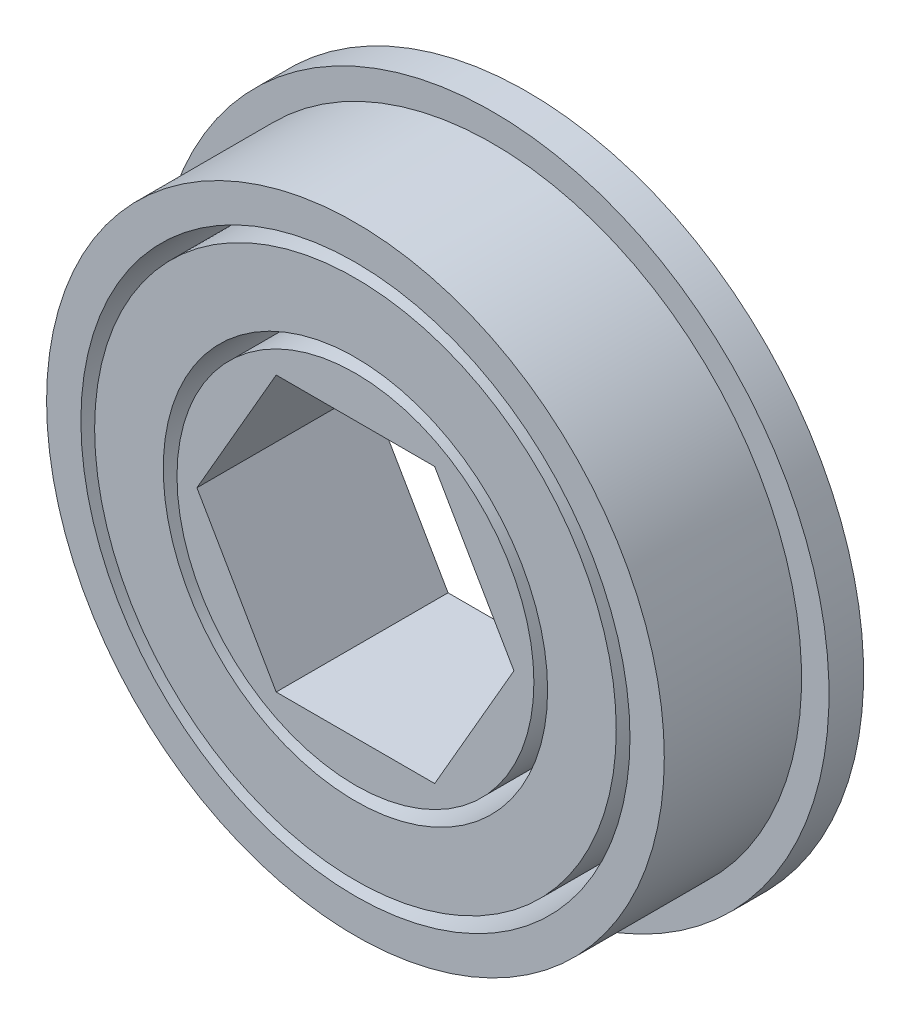
from build123d import *

# Parameters (mm, degrees)
CROQUIS1_R              = 14.2875
SALIENTE_EXTRUIR1_DEPTH = 7.9502
CROQUIS2_R              = 15.5575
CROQUIS2_R_2            = 14.2875
SALIENTE_EXTRUIR2_DEPTH = 1.6002
CROQUIS3_R              = 12.7
CROQUIS3_R_2            = 12.065
CROQUIS3_R_3            = 8.89
CROQUIS3_R_4            = 8.255
CORTAR_EXTRUIR1_DEPTH   = 25.4


with BuildPart() as part:
    # Croquis1 → Saliente-Extruir1 (new body)
    with BuildSketch(Plane.XY):
        Circle(CROQUIS1_R)
        Polygon((7.332348419, 0), (3.666174209, 6.35), (-3.666174209, 6.35), (-7.332348419, 0), (-3.666174209, -6.35), (3.666174209, -6.35), align=None, mode=Mode.SUBTRACT)
    extrude(amount=SALIENTE_EXTRUIR1_DEPTH)

    # Croquis2 → Saliente-Extruir2 (add)
    with BuildSketch(Plane(origin=(0, 0, 0), x_dir=(-1, 0, 0), z_dir=(0, 0, -1))):
        Circle(CROQUIS2_R)
        Circle(CROQUIS2_R_2, mode=Mode.SUBTRACT)
    extrude(amount=-SALIENTE_EXTRUIR2_DEPTH)

    # Croquis3 → Cortar-Extruir1 (cut)
    # profile 1 of 2: a face of its own
    with BuildSketch(Plane.XY.offset(7.9502)):
        Circle(CROQUIS3_R)
        Circle(CROQUIS3_R_2, mode=Mode.SUBTRACT)
    # profile 2 of 2: a face of its own
    with BuildSketch(Plane.XY.offset(7.9502)):
        Circle(CROQUIS3_R_3)
        Circle(CROQUIS3_R_4, mode=Mode.SUBTRACT)
    extrude(amount=-CORTAR_EXTRUIR1_DEPTH, mode=Mode.SUBTRACT)


with BuildPart() as cortar_extruir1_piece_1:
    # of the separate pieces the step leaves, piece 1, a body of its own (cortar_extruir1_pieces)
    add(part.part.solids().sort_by_distance((12.065, 0, 7.9502))[0])


with BuildPart() as cortar_extruir1_piece_2:
    # of the separate pieces the step leaves, piece 2, a body of its own (cortar_extruir1_pieces)
    add(part.part.solids().sort_by_distance((14.2875, 0, 1.6002))[0])


with BuildPart() as cortar_extruir1_piece_3:
    # of the separate pieces the step leaves, piece 3, a body of its own (cortar_extruir1_pieces)
    add(part.part.solids().sort_by_distance((8.255, 0, 7.9502))[0])


solid = Compound([cortar_extruir1_piece_1.part, cortar_extruir1_piece_2.part, cortar_extruir1_piece_3.part])
